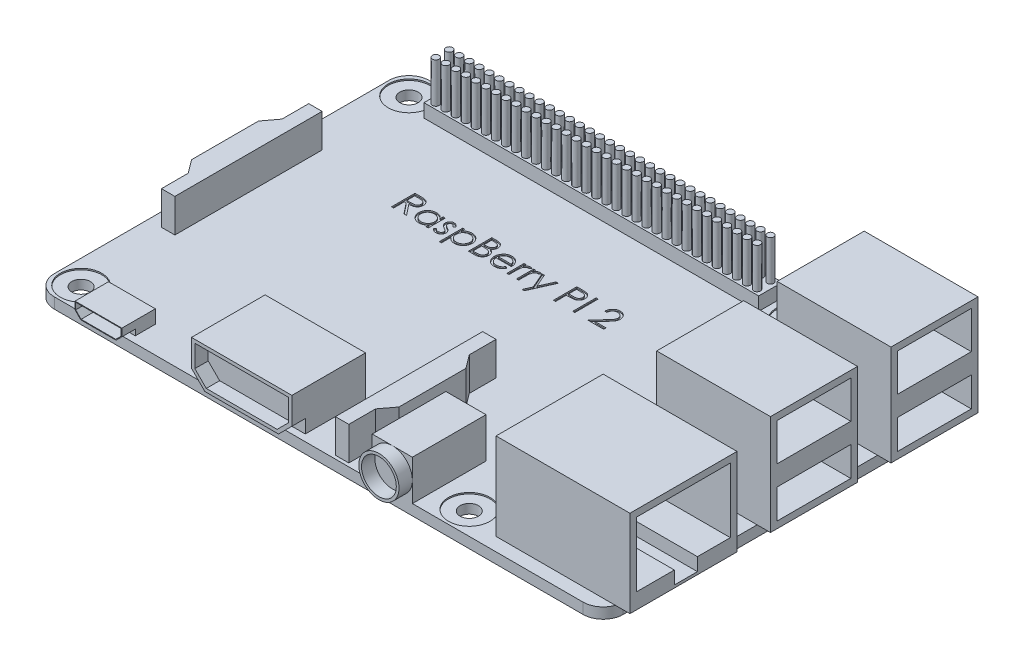
from build123d import *

# Parameters (mm, degrees)
ESQUISSE1_R              = 1.375
PLAQUE_DEPTH             = 1.6
ESQUISSE2_W              = 17
ESQUISSE2_H              = 13
USB_DEPTH                = 15
ESQUISSE3_W              = 20
ESQUISSE3_H              = 16
RJ45_DEPTH               = 13
ESQUISSE4_W              = 50
ESQUISSE4_H              = 3.531908002
GPIO_BASE_DEPTH          = 2
ESQUISSE5_R              = 0.5
GPIO_PINS_DEPTH          = 6
ESQUISSE6_W              = 15
ESQUISSE6_H              = 11
HDMI_DEPTH               = 6
ESQUISSE9_W              = 11
ESQUISSE9_H              = 4.4
ESQUISSE9_H_2            = 5.6
USB_RJ45_VIDE_DEPTH      = 10
HDMI_VIDE_DEPTH          = 2
ESQUISSE11_W             = 0.314102564
ESQUISSE11_H             = 3.5
RASPBERRY_PI_2_DEPTH     = 0.2
CONNECTIQUES_DEPTH       = 5
MICRO_SD_DEPTH           = 1
ESQUISSE14_W             = 6
ESQUISSE14_H             = 11
JACK_BASE_DEPTH          = 6
ESQUISSE15_R             = 3
ESQUISSE15_R_2           = 2.6
JACK_ROND_DEPTH          = 2
ESQUISSE16_R             = 3.1
TROU_FIXATION_VIDE_DEPTH = 0.2
ESQUISSE17_W             = 7
ESQUISSE17_H             = 5
MICRO_USB_BASE_DEPTH     = 2
MICRO_USB_VIDE_DEPTH     = 2


with BuildPart() as part:
    # Esquisse1 → plaque (new body)
    with BuildSketch(Plane(origin=(0, 0, 0), x_dir=(1, 0, 0), z_dir=(0, 1, 0))):
        with BuildLine():
            Line((39.5, 28), (-39.5, 28))
            ThreePointArc((-39.5, 28), (-41.621320344, 27.121320344), (-42.5, 25))
            Line((-42.5, 25), (-42.5, -25))
            ThreePointArc((-42.5, -25), (-41.621320344, -27.121320344), (-39.5, -28))
            Line((-39.5, -28), (39.5, -28))
            ThreePointArc((39.5, -28), (41.621320344, -27.121320344), (42.5, -25))
            Line((42.5, -25), (42.5, 25))
            ThreePointArc((42.5, 25), (41.621320344, 27.121320344), (39.5, 28))
        make_face()
        with Locations((-39, 24.5)):
            Circle(ESQUISSE1_R, mode=Mode.SUBTRACT)
        with Locations((19, 24.5)):
            Circle(ESQUISSE1_R, mode=Mode.SUBTRACT)
        with Locations((19, -24.5)):
            Circle(ESQUISSE1_R, mode=Mode.SUBTRACT)
        with Locations((-39, -24.5)):
            Circle(ESQUISSE1_R, mode=Mode.SUBTRACT)
    extrude(amount=PLAQUE_DEPTH)

    # Esquisse2 → USB (add)
    with BuildSketch(Plane(origin=(0, 1.6, 0), x_dir=(1, 0, 0), z_dir=(0, 1, 0))):
        with Locations((36, 19.5)):
            Rectangle(ESQUISSE2_W, ESQUISSE2_H)
        with Locations((36, 1.5)):
            Rectangle(ESQUISSE2_W, ESQUISSE2_H)
    extrude(amount=USB_DEPTH)

    # Esquisse3 → RJ45 (add)
    with BuildSketch(Plane(origin=(0, 1.6, 0), x_dir=(1, 0, 0), z_dir=(0, 1, 0))):
        with Locations((34.5, -18)):
            Rectangle(ESQUISSE3_W, ESQUISSE3_H)
    extrude(amount=RJ45_DEPTH)

    # Esquisse4 → GPIO_Base (add)
    with BuildSketch(Plane(origin=(0, 1.6, 0), x_dir=(1, 0, 0), z_dir=(0, 1, 0))):
        with Locations((-10, 24.5)):
            Rectangle(ESQUISSE4_W, ESQUISSE4_H)
    extrude(amount=GPIO_BASE_DEPTH)

    # Esquisse5 → GPIO_Pins (add)
    with BuildSketch(Plane(origin=(0, 3.6, 0), x_dir=(1, 0, 0), z_dir=(0, 1, 0))):
        with Locations((-34, 25.5)):
            Circle(ESQUISSE5_R)
        with Locations((-32.5, 25.5)):
            Circle(ESQUISSE5_R)
        with Locations((-31, 25.5)):
            Circle(ESQUISSE5_R)
        with Locations((-29.5, 25.5)):
            Circle(ESQUISSE5_R)
        with Locations((-28, 25.5)):
            Circle(ESQUISSE5_R)
        with Locations((-26.5, 25.5)):
            Circle(ESQUISSE5_R)
        with Locations((-25, 25.5)):
            Circle(ESQUISSE5_R)
        with Locations((-23.5, 25.5)):
            Circle(ESQUISSE5_R)
        with Locations((-22, 25.5)):
            Circle(ESQUISSE5_R)
        with Locations((-20.5, 25.5)):
            Circle(ESQUISSE5_R)
        with Locations((-19, 25.5)):
            Circle(ESQUISSE5_R)
        with Locations((-17.5, 25.5)):
            Circle(ESQUISSE5_R)
        with Locations((-16, 25.5)):
            Circle(ESQUISSE5_R)
        with Locations((-14.5, 25.5)):
            Circle(ESQUISSE5_R)
        with Locations((-13, 25.5)):
            Circle(ESQUISSE5_R)
        with Locations((-11.5, 25.5)):
            Circle(ESQUISSE5_R)
        with Locations((-10, 25.5)):
            Circle(ESQUISSE5_R)
        with Locations((-8.5, 25.5)):
            Circle(ESQUISSE5_R)
        with Locations((-7, 25.5)):
            Circle(ESQUISSE5_R)
        with Locations((-5.5, 25.5)):
            Circle(ESQUISSE5_R)
        with Locations((-4, 25.5)):
            Circle(ESQUISSE5_R)
        with Locations((-2.5, 25.5)):
            Circle(ESQUISSE5_R)
        with Locations((-1, 25.5)):
            Circle(ESQUISSE5_R)
        with Locations((0.5, 25.5)):
            Circle(ESQUISSE5_R)
        with Locations((2, 25.5)):
            Circle(ESQUISSE5_R)
        with Locations((3.5, 25.5)):
            Circle(ESQUISSE5_R)
        with Locations((5, 25.5)):
            Circle(ESQUISSE5_R)
        with Locations((6.5, 25.5)):
            Circle(ESQUISSE5_R)
        with Locations((8, 25.5)):
            Circle(ESQUISSE5_R)
        with Locations((9.5, 25.5)):
            Circle(ESQUISSE5_R)
        with Locations((11, 25.5)):
            Circle(ESQUISSE5_R)
        with Locations((12.5, 25.5)):
            Circle(ESQUISSE5_R)
        with Locations((14, 25.5)):
            Circle(ESQUISSE5_R)
        with Locations((-32.5, 23.5)):
            Circle(ESQUISSE5_R)
        with Locations((-31, 23.5)):
            Circle(ESQUISSE5_R)
        with Locations((-29.5, 23.5)):
            Circle(ESQUISSE5_R)
        with Locations((-28, 23.5)):
            Circle(ESQUISSE5_R)
        with Locations((-26.5, 23.5)):
            Circle(ESQUISSE5_R)
        with Locations((-25, 23.5)):
            Circle(ESQUISSE5_R)
        with Locations((-23.5, 23.5)):
            Circle(ESQUISSE5_R)
        with Locations((-22, 23.5)):
            Circle(ESQUISSE5_R)
        with Locations((-20.5, 23.5)):
            Circle(ESQUISSE5_R)
        with Locations((-19, 23.5)):
            Circle(ESQUISSE5_R)
        with Locations((-17.5, 23.5)):
            Circle(ESQUISSE5_R)
        with Locations((-16, 23.5)):
            Circle(ESQUISSE5_R)
        with Locations((-14.5, 23.5)):
            Circle(ESQUISSE5_R)
        with Locations((-13, 23.5)):
            Circle(ESQUISSE5_R)
        with Locations((-11.5, 23.5)):
            Circle(ESQUISSE5_R)
        with Locations((-10, 23.5)):
            Circle(ESQUISSE5_R)
        with Locations((-8.5, 23.5)):
            Circle(ESQUISSE5_R)
        with Locations((-7, 23.5)):
            Circle(ESQUISSE5_R)
        with Locations((-5.5, 23.5)):
            Circle(ESQUISSE5_R)
        with Locations((-4, 23.5)):
            Circle(ESQUISSE5_R)
        with Locations((-2.5, 23.5)):
            Circle(ESQUISSE5_R)
        with Locations((-1, 23.5)):
            Circle(ESQUISSE5_R)
        with Locations((0.5, 23.5)):
            Circle(ESQUISSE5_R)
        with Locations((2, 23.5)):
            Circle(ESQUISSE5_R)
        with Locations((3.5, 23.5)):
            Circle(ESQUISSE5_R)
        with Locations((5, 23.5)):
            Circle(ESQUISSE5_R)
        with Locations((6.5, 23.5)):
            Circle(ESQUISSE5_R)
        with Locations((8, 23.5)):
            Circle(ESQUISSE5_R)
        with Locations((9.5, 23.5)):
            Circle(ESQUISSE5_R)
        with Locations((11, 23.5)):
            Circle(ESQUISSE5_R)
        with Locations((12.5, 23.5)):
            Circle(ESQUISSE5_R)
        with Locations((14, 23.5)):
            Circle(ESQUISSE5_R)
        with Locations((-34, 23.5)):
            Circle(ESQUISSE5_R)
    extrude(amount=GPIO_PINS_DEPTH)

    # Esquisse6 → HDMI (add)
    with BuildSketch(Plane(origin=(0, 1.6, 0), x_dir=(1, 0, 0), z_dir=(0, 1, 0))):
        with Locations((-10.5, -23.5)):
            Rectangle(ESQUISSE6_W, ESQUISSE6_H)
    extrude(amount=HDMI_DEPTH)

    # Esquisse9 → USB - RJ45 - VIDE (cut)
    with BuildSketch(Plane(origin=(44.5, 0, 0), x_dir=(0, 0, -1), z_dir=(1, 0, 0))):
        with Locations((1.5, 4.8)):
            Rectangle(ESQUISSE9_W, ESQUISSE9_H)
        with Locations((1.5, 12.8)):
            Rectangle(ESQUISSE9_W, ESQUISSE9_H_2)
        with Locations((19.5, 4.8)):
            Rectangle(ESQUISSE9_W, ESQUISSE9_H)
        with Locations((19.5, 12.8)):
            Rectangle(ESQUISSE9_W, ESQUISSE9_H_2)
        Polygon((-25, 13.6), (-11, 13.6), (-11, 3.939955321), (-15.916596502, 3.939955321), (-15.916596502, 2), (-19.365847703, 2), (-19.365847703, 3.939955321), (-25, 3.939955321), align=None)
    extrude(amount=-USB_RJ45_VIDE_DEPTH, mode=Mode.SUBTRACT)

    # Esquisse10 → HDMI - VIDE (cut)
    with BuildSketch(Plane.XY.offset(29)):
        Polygon((-15.792893219, 2.1), (-5.207106781, 2.1), (-3.5, 3.807106781), (-3.5, 7.1), (-17.5, 7.1), (-17.5, 3.807106781), align=None)
        Polygon((-3, 3.6), (-5, 1.6), (-3, 1.6), align=None)
        Polygon((-16, 1.6), (-18, 3.6), (-18, 1.6), align=None)
    extrude(amount=-HDMI_VIDE_DEPTH, mode=Mode.SUBTRACT)

    # Esquisse11 → RaspBerry Pi 2 (cut)
    # profile 1 of 12: a face of its own
    with BuildSketch(Plane(origin=(0, 1.6, 0), x_dir=(1, 0, 0), z_dir=(0, 1, 0))):
        with BuildLine():
            Line((-25.952838551, 12.338157917), (-25.252417878, 12.338157917))
            add(Edge.make_bspline(
                [(-25.252417878, 12.338157917), (-25.205676749, 12.338002331), (-25.115928605, 12.337703588), (-24.987355334, 12.336037825), (-24.870528237, 12.33126347), (-24.765508398, 12.327154886), (-24.672297743, 12.319662945), (-24.590610452, 12.312502298), (-24.520822755, 12.303128637), (-24.478576903, 12.294423214), (-24.459449128, 12.290481635)],
                knots=[0, 0, 0, 0, 1.410062039, 2.707475311, 3.878576406, 4.937260626, 5.877586885, 6.699081471, 7.410979367, 8, 8, 8, 8], degree=3))
            add(Edge.make_bspline(
                [(-24.459449128, 12.290481635), (-24.433842503, 12.284154869), (-24.383175514, 12.271636306), (-24.310225448, 12.245176705), (-24.240711124, 12.21455708), (-24.1749213, 12.17859336), (-24.113185508, 12.13701858), (-24.054867198, 12.090550458), (-23.999701734, 12.039443252), (-23.949920104, 11.98240841), (-23.902981052, 11.922571901), (-23.863392426, 11.857868144), (-23.829265946, 11.790206616), (-23.802095429, 11.718899199), (-23.780217456, 11.644637427), (-23.764791216, 11.56674863), (-23.755540029, 11.485587655), (-23.754598173, 11.430229746), (-23.754120602, 11.40216032)],
                knots=[0, 0, 0, 0, 1.027469482, 2.033020251, 3.019912614, 3.986113645, 4.951240523, 5.91722682, 6.890402269, 7.87763091, 8.8651537, 9.85103654, 10.82876324, 11.815024772, 12.821070561, 13.842952187, 14.906261191, 16, 16, 16, 16], degree=3))
            add(Edge.make_bspline(
                [(-23.754120602, 11.40216032), (-23.7555896, 11.355525216), (-23.758455996, 11.264528048), (-23.785181099, 11.132467167), (-23.828957619, 11.009277852), (-23.889280908, 10.895115214), (-23.966100384, 10.792204569), (-24.058425175, 10.701814113), (-24.166306787, 10.626174201), (-24.266736102, 10.573721396), (-24.355450302, 10.540128487), (-24.428483615, 10.516492129), (-24.508150592, 10.498230163), (-24.593687927, 10.481870032), (-24.685451583, 10.469518337), (-24.783221622, 10.460471743), (-24.887067774, 10.454817694), (-24.958406843, 10.453975689), (-24.995106179, 10.453542532)],
                knots=[0, 0, 0, 0, 1.260483769, 2.459530307, 3.627416485, 4.787058657, 5.939039949, 7.08810263, 8.267026773, 9.491475466, 10.141966685, 10.831826277, 11.566392101, 12.351337768, 13.187381173, 14.07005841, 15.007169909, 16, 16, 16, 16], degree=3))
            Line((-24.995106179, 10.453542532), (-23.709248807, 8.838157917))
            Line((-23.709248807, 8.838157917), (-24.097670281, 8.838157917))
            Line((-24.097670281, 8.838157917), (-25.383527653, 10.453542532))
            Line((-25.383527653, 10.453542532), (-25.638735987, 10.453542532))
            Line((-25.638735987, 10.453542532), (-25.638735987, 8.838157917))
            Line((-25.638735987, 8.838157917), (-25.952838551, 8.838157917))
            Line((-25.952838551, 8.838157917), (-25.952838551, 12.338157917))
        make_face()
        with BuildLine():
            Line((-25.638735987, 11.979183558), (-25.638735987, 10.812516891))
            Line((-25.638735987, 10.812516891), (-24.997910666, 10.807609038))
            add(Edge.make_bspline(
                [(-24.997910666, 10.807609038), (-24.967990627, 10.807595802), (-24.90999707, 10.807570145), (-24.826096405, 10.811563922), (-24.747976293, 10.81610724), (-24.675935541, 10.823056585), (-24.609941966, 10.832012657), (-24.550028553, 10.843215641), (-24.496097501, 10.856267704), (-24.433198962, 10.87646933), (-24.362962431, 10.908475348), (-24.286630971, 10.955040847), (-24.221628633, 11.013609966), (-24.166710771, 11.080583422), (-24.12258134, 11.154219671), (-24.091469285, 11.23363604), (-24.071726843, 11.316827638), (-24.069398298, 11.374005746), (-24.068223166, 11.402861442)],
                knots=[0, 0, 0, 0, 1.146690395, 2.22261258, 3.21895312, 4.145990853, 4.996080663, 5.770904154, 6.481378293, 7.121626537, 8.300444488, 9.431385265, 10.535395872, 11.636531494, 12.74115979, 13.810798291, 14.895190096, 16, 16, 16, 16], degree=3))
            add(Edge.make_bspline(
                [(-24.068223166, 11.402861442), (-24.069425287, 11.431008016), (-24.071807452, 11.486784255), (-24.091256221, 11.568440165), (-24.124145602, 11.645507115), (-24.16846784, 11.7176716), (-24.222466995, 11.783177336), (-24.285784808, 11.839224489), (-24.356690003, 11.885473954), (-24.422961201, 11.915028334), (-24.482195414, 11.933148187), (-24.533625074, 11.945899351), (-24.591736552, 11.95614382), (-24.65681201, 11.964351881), (-24.728573641, 11.971406825), (-24.807384292, 11.976158604), (-24.892721072, 11.978972468), (-24.951868004, 11.979111557), (-24.982485987, 11.979183558)],
                knots=[0, 0, 0, 0, 1.101028733, 2.181837193, 3.264309656, 4.369019818, 5.486613113, 6.575447106, 7.666700264, 8.788928104, 9.402425223, 10.0903467, 10.862060571, 11.710948788, 12.657782767, 13.684531032, 14.801375019, 16, 16, 16, 16], degree=3))
            Line((-24.982485987, 11.979183558), (-25.638735987, 11.979183558))
        make_face(mode=Mode.SUBTRACT)
    # profile 2 of 12: a face of its own
    with BuildSketch(Plane(origin=(0, 1.6, 0), x_dir=(1, 0, 0), z_dir=(0, 1, 0))):
        with BuildLine():
            Line((-20.478479576, 11.395850224), (-20.478479576, 8.838157917))
            Line((-20.478479576, 8.838157917), (-20.79258214, 8.838157917))
            Line((-20.79258214, 8.838157917), (-20.79258214, 9.280565769))
            add(Edge.make_bspline(
                [(-20.79258214, 9.280565769), (-20.828000931, 9.240526175), (-20.897121146, 9.162388404), (-21.012562264, 9.060306232), (-21.134930442, 8.97592791), (-21.263631763, 8.907777994), (-21.398550007, 8.856585938), (-21.539386094, 8.820199779), (-21.686197475, 8.796805944), (-21.78644983, 8.794469922), (-21.837253615, 8.793286122)],
                knots=[0, 0, 0, 0, 1.074387032, 2.096679803, 3.090159297, 4.057316773, 5.018401886, 5.985159533, 6.978961417, 8, 8, 8, 8], degree=3))
            add(Edge.make_bspline(
                [(-21.837253615, 8.793286122), (-21.882421569, 8.794512494), (-21.971494773, 8.796930954), (-22.102523851, 8.815693258), (-22.2286161, 8.84582388), (-22.349890673, 8.887724769), (-22.465562818, 8.943305591), (-22.576622915, 9.009846839), (-22.682495607, 9.089087669), (-22.781567146, 9.179675697), (-22.872799146, 9.278070684), (-22.952860419, 9.383016231), (-23.019613499, 9.494058535), (-23.075433579, 9.609791689), (-23.118429924, 9.731106609), (-23.148403558, 9.857583777), (-23.167144005, 9.98907365), (-23.169561465, 10.078613173), (-23.170787269, 10.124015288)],
                knots=[0, 0, 0, 0, 1.033919861, 2.038935746, 3.024066025, 3.998881131, 4.97069526, 5.957263378, 6.95902576, 7.993208707, 9.027059324, 10.027763471, 11.009749337, 11.988697705, 12.965288445, 13.950418724, 14.960734635, 16, 16, 16, 16], degree=3))
            add(Edge.make_bspline(
                [(-23.170787269, 10.124015288), (-23.169534297, 10.168478992), (-23.16705724, 10.256381335), (-23.148604021, 10.385660033), (-23.117573012, 10.510178294), (-23.074025164, 10.629535237), (-23.018183209, 10.743875287), (-22.950255122, 10.853279312), (-22.870235997, 10.95804871), (-22.77798359, 11.055719937), (-22.67804882, 11.145940551), (-22.571140089, 11.224349596), (-22.459916808, 11.292066445), (-22.342653798, 11.345719922), (-22.221086693, 11.389129026), (-22.094133247, 11.419161994), (-21.962321668, 11.436859315), (-21.872831176, 11.43942208), (-21.82743791, 11.440722019)],
                knots=[0, 0, 0, 0, 1.020392517, 2.01726096, 2.990465484, 3.961182959, 4.928053699, 5.906110375, 6.912531644, 7.948652711, 8.985773172, 9.998621852, 10.987621588, 11.969261332, 12.953316658, 13.946091881, 14.958173133, 16, 16, 16, 16], degree=3))
            add(Edge.make_bspline(
                [(-21.82743791, 11.440722019), (-21.775238051, 11.439284268), (-21.672876591, 11.436464905), (-21.523148581, 11.413002177), (-21.381504103, 11.37336371), (-21.246849751, 11.319446212), (-21.119669065, 11.247797483), (-21.001166081, 11.157417522), (-20.890100598, 11.048876335), (-20.825720306, 10.965505891), (-20.79258214, 10.922593013)],
                knots=[0, 0, 0, 0, 1.038897134, 2.037228247, 3.008116434, 3.962042015, 4.918381754, 5.904844433, 6.921570401, 8, 8, 8, 8], degree=3))
            Line((-20.79258214, 10.922593013), (-20.79258214, 11.395850224))
            Line((-20.79258214, 11.395850224), (-20.478479576, 11.395850224))
        make_face()
        with BuildLine():
            add(Edge.make_bspline(
                [(-21.823231179, 11.126619455), (-21.869145517, 11.124985817), (-21.959773117, 11.121761276), (-22.092817119, 11.096587781), (-22.220130533, 11.054703187), (-22.341076607, 10.997421286), (-22.453744824, 10.925392549), (-22.554438495, 10.838271166), (-22.643981196, 10.738434152), (-22.71928946, 10.626332041), (-22.780679957, 10.50615395), (-22.823846989, 10.380529512), (-22.852316236, 10.251724534), (-22.855224757, 10.164361849), (-22.856684704, 10.120509679)],
                knots=[0, 0, 0, 0, 1.031046209, 2.035121221, 3.029706178, 4.034933723, 5.034054252, 6.02443088, 7.017295772, 8.038157696, 9.050218397, 10.03989886, 11.016116709, 12, 12, 12, 12], degree=3))
            add(Edge.make_bspline(
                [(-22.856684704, 10.120509679), (-22.854819811, 10.076919572), (-22.851097334, 9.989910216), (-22.82434664, 9.86092964), (-22.779466766, 9.735275598), (-22.718224704, 9.614014604), (-22.641538079, 9.501430504), (-22.552649426, 9.399690381), (-22.450699145, 9.312200793), (-22.337771638, 9.238963219), (-22.217163668, 9.179800698), (-22.090329736, 9.138635059), (-21.959654098, 9.112057278), (-21.870801764, 9.108952801), (-21.826035666, 9.107388686)],
                knots=[0, 0, 0, 0, 0.979072187, 1.954306742, 2.945804271, 3.96968567, 4.997920485, 5.998718438, 6.996577872, 8.005894225, 9.015743152, 10.005417472, 10.995077863, 12, 12, 12, 12], degree=3))
            add(Edge.make_bspline(
                [(-21.826035666, 9.107388686), (-21.780589163, 9.10904865), (-21.690200577, 9.112350153), (-21.556761869, 9.137631419), (-21.427266906, 9.179400217), (-21.303479678, 9.237299344), (-21.188163547, 9.3090567), (-21.084665669, 9.393063791), (-20.997149701, 9.490766975), (-20.922957091, 9.598143428), (-20.864781674, 9.715855424), (-20.822405615, 9.841189615), (-20.797351709, 9.974150363), (-20.79419398, 10.06501429), (-20.79258214, 10.111395096)],
                knots=[0, 0, 0, 0, 1.01762866, 2.023962475, 3.030623092, 4.058876274, 5.077231937, 6.066672613, 7.034107872, 8.005628644, 8.981990164, 9.965428785, 10.961468474, 12, 12, 12, 12], degree=3))
            add(Edge.make_bspline(
                [(-20.79258214, 10.111395096), (-20.793541797, 10.146732927), (-20.795430704, 10.21628896), (-20.809861274, 10.318416478), (-20.8328162, 10.416150204), (-20.86516237, 10.509592893), (-20.907653655, 10.598227908), (-20.95890142, 10.682691668), (-21.01980687, 10.76254488), (-21.089389566, 10.836687951), (-21.165554769, 10.904314413), (-21.246149309, 10.964678654), (-21.332128056, 11.014267426), (-21.422045093, 11.055308698), (-21.516056428, 11.087967848), (-21.614927048, 11.109755541), (-21.717606035, 11.124715863), (-21.78765209, 11.125978243), (-21.823231179, 11.126619455)],
                knots=[0, 0, 0, 0, 1.050140795, 2.067009409, 3.05949893, 4.030605086, 5.00011959, 5.97591094, 6.962425594, 7.979863591, 8.993523472, 9.986985069, 10.967611495, 11.937549037, 12.921786183, 13.919465291, 14.943216303, 16, 16, 16, 16], degree=3))
        make_face(mode=Mode.SUBTRACT)
    # profile 3 of 12: a face of its own
    with BuildSketch(Plane(origin=(0, 1.6, 0), x_dir=(1, 0, 0), z_dir=(0, 1, 0))):
        with BuildLine():
            Line((-18.548992397, 11.076839808), (-18.762133422, 10.857388686))
            add(Edge.make_bspline(
                [(-18.762133422, 10.857388686), (-18.780523926, 10.878701832), (-18.815978652, 10.919791069), (-18.872210133, 10.974728136), (-18.928233736, 11.020865075), (-18.98328255, 11.059817334), (-19.038740819, 11.08926648), (-19.093957737, 11.110761342), (-19.148990476, 11.124063148), (-19.185776511, 11.125777586), (-19.203840153, 11.126619455)],
                knots=[0, 0, 0, 0, 1.26578478, 2.440284043, 3.530471711, 4.527705817, 5.468200915, 6.346673037, 7.188140097, 8, 8, 8, 8], degree=3))
            add(Edge.make_bspline(
                [(-19.203840153, 11.126619455), (-19.225979543, 11.125544582), (-19.269546729, 11.123429384), (-19.331972547, 11.102315954), (-19.389923172, 11.069907215), (-19.440080152, 11.023938632), (-19.482567832, 10.971174363), (-19.513581513, 10.912178038), (-19.532547497, 10.848729994), (-19.534952229, 10.804700137), (-19.536171884, 10.782368654)],
                knots=[0, 0, 0, 0, 0.99966794, 1.967205029, 2.953328237, 3.988086729, 5.028030931, 6.008226631, 6.989793394, 8, 8, 8, 8], degree=3))
            add(Edge.make_bspline(
                [(-19.536171884, 10.782368654), (-19.535061072, 10.76215661), (-19.532842579, 10.721789499), (-19.515595899, 10.662241465), (-19.488129827, 10.604184427), (-19.462459633, 10.56862152), (-19.449232781, 10.55029734)],
                knots=[0, 0, 0, 0, 0.960159726, 1.917612774, 2.927026955, 4, 4, 4, 4], degree=3))
            add(Edge.make_bspline(
                [(-19.449232781, 10.55029734), (-19.441269288, 10.540512755), (-19.424319995, 10.519687501), (-19.39251148, 10.490783647), (-19.356488977, 10.458841396), (-19.313169039, 10.426904559), (-19.264418011, 10.393272834), (-19.209178727, 10.359270701), (-19.149204222, 10.322306276), (-19.106266916, 10.298861841), (-19.083948326, 10.286675545)],
                knots=[0, 0, 0, 0, 0.66740084, 1.420478572, 2.27185888, 3.217733974, 4.268547843, 5.408967954, 6.65319498, 8, 8, 8, 8], degree=3))
            add(Edge.make_bspline(
                [(-19.083948326, 10.286675545), (-19.056734749, 10.271430642), (-19.004167079, 10.24198251), (-18.929474312, 10.196272806), (-18.861687271, 10.150841382), (-18.800231603, 10.106174108), (-18.746289794, 10.06102124), (-18.698225242, 10.017113483), (-18.657236798, 9.973124175), (-18.634282871, 9.942391061), (-18.623311307, 9.927701186)],
                knots=[0, 0, 0, 0, 1.27191281, 2.456916733, 3.569705269, 4.599008579, 5.553216877, 6.436649441, 7.252746552, 8, 8, 8, 8], degree=3))
            add(Edge.make_bspline(
                [(-18.623311307, 9.927701186), (-18.60510078, 9.898035098), (-18.56885845, 9.838994077), (-18.530800184, 9.741775649), (-18.508739909, 9.638665147), (-18.505677689, 9.568132927), (-18.504120602, 9.532268494)],
                knots=[0, 0, 0, 0, 0.995354457, 1.980940102, 2.973342416, 4, 4, 4, 4], degree=3))
            add(Edge.make_bspline(
                [(-18.504120602, 9.532268494), (-18.504840136, 9.506999347), (-18.506258056, 9.457203734), (-18.516116123, 9.383868904), (-18.533071099, 9.313734347), (-18.556164853, 9.246039062), (-18.587349226, 9.182080123), (-18.623897023, 9.120243874), (-18.667771935, 9.061867943), (-18.71786331, 9.007028983), (-18.772708804, 8.956943235), (-18.831214943, 8.912919281), (-18.893453773, 8.876344944), (-18.958980575, 8.846079599), (-19.027944229, 8.822011341), (-19.100355518, 8.80534881), (-19.175984273, 8.795376049), (-19.227414081, 8.793991572), (-19.253619801, 8.793286122)],
                knots=[0, 0, 0, 0, 1.032770009, 2.035186124, 3.017557409, 3.978232242, 4.952395191, 5.920591857, 6.910227898, 7.931268572, 8.952309245, 9.941945286, 10.918353717, 11.897095711, 12.887975737, 13.898235213, 14.929059601, 16, 16, 16, 16], degree=3))
            add(Edge.make_bspline(
                [(-19.253619801, 8.793286122), (-19.288986976, 8.794278822), (-19.359229903, 8.796250429), (-19.463119622, 8.81475649), (-19.564640381, 8.843551884), (-19.663023921, 8.883267819), (-19.756070035, 8.933418531), (-19.84120096, 8.993480925), (-19.918712422, 9.061470922), (-19.962830696, 9.113583833), (-19.984889833, 9.139640288)],
                knots=[0, 0, 0, 0, 1.013940152, 2.01379169, 3.017749504, 4.037548394, 5.051665909, 6.043208538, 7.021604269, 8, 8, 8, 8], degree=3))
            Line((-19.984889833, 9.139640288), (-19.77665666, 9.376619455))
            add(Edge.make_bspline(
                [(-19.77665666, 9.376619455), (-19.756884247, 9.355264691), (-19.718552434, 9.313865251), (-19.657251218, 9.25874091), (-19.594871817, 9.212539639), (-19.53203713, 9.173896224), (-19.467817036, 9.144120821), (-19.402571421, 9.123202227), (-19.336432997, 9.109758035), (-19.292010861, 9.108179752), (-19.269745602, 9.107388686)],
                knots=[0, 0, 0, 0, 1.179806542, 2.287233372, 3.337373186, 4.324005949, 5.273901747, 6.200048787, 7.097828587, 8, 8, 8, 8], degree=3))
            add(Edge.make_bspline(
                [(-19.269745602, 9.107388686), (-19.239427676, 9.108759511), (-19.180191534, 9.111437873), (-19.095347776, 9.135754965), (-19.017009149, 9.173884916), (-18.948985804, 9.227969615), (-18.891083643, 9.290925187), (-18.849155468, 9.361839306), (-18.822879293, 9.438630763), (-18.819793294, 9.491863066), (-18.818223166, 9.518947179)],
                knots=[0, 0, 0, 0, 1.072336372, 2.095165389, 3.102688358, 4.141489647, 5.156069229, 6.117746104, 7.042326257, 8, 8, 8, 8], degree=3))
            add(Edge.make_bspline(
                [(-18.818223166, 9.518947179), (-18.81930946, 9.541256798), (-18.821454203, 9.585304154), (-18.838297475, 9.649054495), (-18.864910327, 9.709523775), (-18.891114976, 9.744913423), (-18.904461147, 9.762937564)],
                knots=[0, 0, 0, 0, 1.013901739, 2.00181326, 2.98231254, 4, 4, 4, 4], degree=3))
            add(Edge.make_bspline(
                [(-18.904461147, 9.762937564), (-18.912483541, 9.771972926), (-18.929959214, 9.791655208), (-18.962014455, 9.820080287), (-19.000396317, 9.850718386), (-19.04553648, 9.883049975), (-19.097525942, 9.91664858), (-19.156575417, 9.951337933), (-19.22187597, 9.988765658), (-19.268046601, 10.013585314), (-19.292181499, 10.026559359)],
                knots=[0, 0, 0, 0, 0.615000592, 1.339693406, 2.178160186, 3.116406724, 4.166410947, 5.330106347, 6.604359322, 8, 8, 8, 8], degree=3))
            add(Edge.make_bspline(
                [(-19.292181499, 10.026559359), (-19.318228139, 10.041098491), (-19.368740887, 10.069294507), (-19.440288178, 10.113210587), (-19.504835532, 10.157877862), (-19.563936107, 10.200790701), (-19.616097112, 10.244211645), (-19.661113061, 10.288188896), (-19.700756276, 10.330948883), (-19.722703688, 10.361246179), (-19.733187108, 10.375718013)],
                knots=[0, 0, 0, 0, 1.262093308, 2.447601706, 3.550203992, 4.582594899, 5.537233252, 6.418365656, 7.244515135, 8, 8, 8, 8], degree=3))
            add(Edge.make_bspline(
                [(-19.733187108, 10.375718013), (-19.751317708, 10.404863628), (-19.787585243, 10.463165043), (-19.822800434, 10.56047552), (-19.847006463, 10.662920577), (-19.849168853, 10.733607431), (-19.850274448, 10.769748461)],
                knots=[0, 0, 0, 0, 0.985009483, 1.970363186, 2.962279964, 4, 4, 4, 4], degree=3))
            add(Edge.make_bspline(
                [(-19.850274448, 10.769748461), (-19.849740253, 10.793373859), (-19.848694757, 10.83961211), (-19.840350705, 10.907550931), (-19.825158994, 10.972099085), (-19.806104071, 11.034225948), (-19.779621067, 11.092728042), (-19.747975162, 11.148385513), (-19.710787737, 11.201121431), (-19.667944446, 11.250124563), (-19.620837801, 11.294633889), (-19.569943031, 11.333432517), (-19.516404775, 11.366538872), (-19.459996355, 11.394304032), (-19.400175882, 11.415305415), (-19.337361496, 11.4297628), (-19.271680341, 11.439418003), (-19.226779215, 11.440281087), (-19.203840153, 11.440722019)],
                knots=[0, 0, 0, 0, 1.087655834, 2.128696564, 3.144119009, 4.137814668, 5.115653402, 6.093965665, 7.082169637, 8.081268856, 9.086088321, 10.061021666, 11.022561449, 11.980240094, 12.950172527, 13.934149372, 14.944599409, 16, 16, 16, 16], degree=3))
            add(Edge.make_bspline(
                [(-19.203840153, 11.440722019), (-19.17664809, 11.439617678), (-19.121753868, 11.437388281), (-19.039399242, 11.41968259), (-18.9571659, 11.390549486), (-18.87484255, 11.350313253), (-18.79303226, 11.298246377), (-18.711015404, 11.235317078), (-18.627807373, 11.161939363), (-18.57585106, 11.105840138), (-18.548992397, 11.076839808)],
                knots=[0, 0, 0, 0, 0.845714091, 1.707292901, 2.609013841, 3.555613372, 4.552488639, 5.621697636, 6.770543573, 8, 8, 8, 8], degree=3))
        make_face()
    # profile 4 of 12: a face of its own
    with BuildSketch(Plane(origin=(0, 1.6, 0), x_dir=(1, 0, 0), z_dir=(0, 1, 0))):
        with BuildLine():
            Line((-17.875915474, 11.395850224), (-17.56181291, 11.395850224))
            Line((-17.56181291, 11.395850224), (-17.56181291, 10.922593013))
            add(Edge.make_bspline(
                [(-17.56181291, 10.922593013), (-17.528455426, 10.965530747), (-17.463631831, 11.048971639), (-17.351906926, 11.156961768), (-17.233980117, 11.248037072), (-17.106816705, 11.319419605), (-16.972393015, 11.373240417), (-16.831260697, 11.413019867), (-16.682221932, 11.436461341), (-16.58032548, 11.439283002), (-16.528359384, 11.440722019)],
                knots=[0, 0, 0, 0, 1.0828784, 2.104357462, 3.088488658, 4.04616522, 5.001424249, 5.969181776, 6.964304535, 8, 8, 8, 8], degree=3))
            add(Edge.make_bspline(
                [(-16.528359384, 11.440722019), (-16.482967781, 11.43940884), (-16.393248892, 11.436813273), (-16.261185664, 11.419240219), (-16.13401028, 11.389122526), (-16.012442226, 11.345721611), (-15.895179161, 11.292066141), (-15.783957061, 11.224349105), (-15.677043505, 11.145942915), (-15.577127316, 11.055710764), (-15.484805949, 10.958082497), (-15.404959768, 10.853060193), (-15.336087863, 10.744097607), (-15.280417567, 10.629505515), (-15.236809219, 10.510186285), (-15.205794542, 10.385657844), (-15.187336898, 10.256381903), (-15.184860447, 10.168479183), (-15.183607781, 10.124015288)],
                knots=[0, 0, 0, 0, 1.041296284, 2.058176809, 3.050446431, 4.034000596, 5.01514041, 6.003636468, 7.015969324, 8.052561599, 9.08815499, 10.094063707, 11.074456064, 12.040834395, 13.011057502, 13.983766392, 14.980127149, 16, 16, 16, 16], degree=3))
            add(Edge.make_bspline(
                [(-15.183607781, 10.124015288), (-15.184833267, 10.07861298), (-15.187250101, 9.989073075), (-15.205995107, 9.857585978), (-15.235951981, 9.731098604), (-15.279010165, 9.609821341), (-15.334651653, 9.493837689), (-15.402356213, 9.383231293), (-15.48224268, 9.27803759), (-15.573543808, 9.17968469), (-15.672596744, 9.089085377), (-15.778474234, 9.009847308), (-15.889533159, 8.943305932), (-16.005205326, 8.887722973), (-16.126480965, 8.845830789), (-16.252794242, 8.815612988), (-16.384076389, 8.796978492), (-16.473377541, 8.79452635), (-16.518543679, 8.793286122)],
                knots=[0, 0, 0, 0, 1.038740735, 2.04854663, 3.033179607, 4.009277356, 4.987731542, 5.972001279, 6.972200261, 8.005528982, 9.039189865, 10.040446548, 11.026516639, 11.997840187, 12.972163198, 13.956796175, 14.96660207, 16, 16, 16, 16], degree=3))
            add(Edge.make_bspline(
                [(-16.518543679, 8.793286122), (-16.569371251, 8.794580929), (-16.669770607, 8.797138554), (-16.816568277, 8.823057964), (-16.957845129, 8.8617949), (-17.092035954, 8.918493894), (-17.220203766, 8.99074941), (-17.341623572, 9.078859615), (-17.456940325, 9.18264024), (-17.526349082, 9.261372056), (-17.56181291, 9.301599423)],
                knots=[0, 0, 0, 0, 1.014726462, 2.004382257, 2.969841629, 3.936926163, 4.907207904, 5.903978561, 6.929055279, 8, 8, 8, 8], degree=3))
            Line((-17.56181291, 9.301599423), (-17.56181291, 7.895850224))
            Line((-17.56181291, 7.895850224), (-17.875915474, 7.895850224))
            Line((-17.875915474, 7.895850224), (-17.875915474, 11.395850224))
        make_face()
        with BuildLine():
            add(Edge.make_bspline(
                [(-16.531163871, 11.126619455), (-16.566743434, 11.125979197), (-16.636790421, 11.124718693), (-16.73946264, 11.109744745), (-16.838358068, 11.088007003), (-16.93248002, 11.055095103), (-17.022730636, 11.01469629), (-17.108414801, 10.964214279), (-17.189472368, 10.904562273), (-17.265699399, 10.836882929), (-17.334562692, 10.762308241), (-17.39552562, 10.682720432), (-17.446732925, 10.598220292), (-17.489234946, 10.50959493), (-17.521578228, 10.416149645), (-17.544533948, 10.318416632), (-17.558964301, 10.216288919), (-17.560853238, 10.146732913), (-17.56181291, 10.111395096)],
                knots=[0, 0, 0, 0, 1.05670511, 2.080379991, 3.077984906, 4.06214886, 5.038337365, 6.01289324, 7.01187578, 8.025460281, 9.038092164, 10.024533457, 11.000252242, 11.969694649, 12.940728589, 13.933144304, 14.949937299, 16, 16, 16, 16], degree=3))
            add(Edge.make_bspline(
                [(-17.56181291, 10.111395096), (-17.560222053, 10.065006984), (-17.557105432, 9.974128742), (-17.531768064, 9.84134462), (-17.4905328, 9.715692965), (-17.432004086, 9.598231928), (-17.358056512, 9.490249093), (-17.268958355, 9.393558486), (-17.165515804, 9.308767895), (-17.049448613, 9.237346642), (-16.925026482, 9.179358575), (-16.79524057, 9.137844365), (-16.661875689, 9.112272136), (-16.571707369, 9.109025317), (-16.526256019, 9.107388686)],
                knots=[0, 0, 0, 0, 1.03728447, 2.032128127, 3.01272805, 3.987917167, 4.958271349, 5.931593992, 6.91984656, 7.941419022, 8.973179163, 9.983609215, 10.983593296, 12, 12, 12, 12], degree=3))
            add(Edge.make_bspline(
                [(-16.526256019, 9.107388686), (-16.481720251, 9.108945063), (-16.393324758, 9.112034191), (-16.263166636, 9.138772379), (-16.136675998, 9.179617403), (-16.016495825, 9.23917696), (-15.903672337, 9.312167018), (-15.801790784, 9.399727051), (-15.71278387, 9.501216994), (-15.636919515, 9.614225497), (-15.57578803, 9.735400881), (-15.52985779, 9.860782269), (-15.503349217, 9.989927692), (-15.499592428, 10.076925405), (-15.497710345, 10.120509679)],
                knots=[0, 0, 0, 0, 1.00104056, 1.986885549, 2.97790532, 3.984399681, 4.995088187, 5.994304198, 6.996462723, 8.023150851, 9.048424203, 10.043036403, 11.019596776, 12, 12, 12, 12], degree=3))
            add(Edge.make_bspline(
                [(-15.497710345, 10.120509679), (-15.499165079, 10.164364669), (-15.502063213, 10.251732972), (-15.530610251, 10.380495875), (-15.573510229, 10.506383851), (-15.636069281, 10.625904401), (-15.71027055, 10.738678484), (-15.800017547, 10.838232363), (-15.900633743, 10.925403035), (-16.013322907, 10.997418445), (-16.134263333, 11.05470394), (-16.261578249, 11.096587579), (-16.394621851, 11.121761329), (-16.485249506, 11.124985835), (-16.531163871, 11.126619455)],
                knots=[0, 0, 0, 0, 0.983928682, 1.960191568, 2.949917689, 3.96440592, 4.982380491, 5.975291189, 6.965713506, 7.964880129, 8.970154049, 9.96478489, 10.968906225, 12, 12, 12, 12], degree=3))
        make_face(mode=Mode.SUBTRACT)
    # profile 5 of 12: a face of its own
    with BuildSketch(Plane(origin=(0, 1.6, 0), x_dir=(1, 0, 0), z_dir=(0, 1, 0))):
        with BuildLine():
            Line((-14.465659063, 12.338157917), (-13.782766435, 12.338157917))
            add(Edge.make_bspline(
                [(-13.782766435, 12.338157917), (-13.749337957, 12.337982166), (-13.684545247, 12.337641518), (-13.590325805, 12.332358387), (-13.502076994, 12.325154717), (-13.419773222, 12.313724625), (-13.343452519, 12.299932847), (-13.272884882, 12.283231031), (-13.20829471, 12.263204418), (-13.131181974, 12.231358136), (-13.043261313, 12.184034968), (-12.94806292, 12.114106403), (-12.866658681, 12.02857394), (-12.796472363, 11.932091284), (-12.740671244, 11.825955513), (-12.700301946, 11.712696324), (-12.674744071, 11.593774582), (-12.672115637, 11.512131404), (-12.670787269, 11.470870256)],
                knots=[0, 0, 0, 0, 1.001505555, 1.941167018, 2.826882275, 3.653841531, 4.429895133, 5.150066043, 5.825578002, 6.45369114, 7.647487171, 8.808567382, 9.977351308, 11.170798116, 12.373658725, 13.556498008, 14.765093433, 16, 16, 16, 16], degree=3))
            add(Edge.make_bspline(
                [(-12.670787269, 11.470870256), (-12.671880487, 11.432217701), (-12.674028764, 11.356261784), (-12.694571524, 11.245167674), (-12.726732192, 11.139416456), (-12.771437441, 11.03939407), (-12.829539437, 10.947360457), (-12.898397756, 10.862573191), (-12.981474559, 10.788622134), (-13.043717799, 10.747279231), (-13.075334544, 10.72627891)],
                knots=[0, 0, 0, 0, 1.044552857, 2.05264487, 3.044412934, 4.028983338, 5.005914585, 5.980388656, 6.974128949, 8, 8, 8, 8], degree=3))
            add(Edge.make_bspline(
                [(-13.075334544, 10.72627891), (-13.035574117, 10.711013911), (-12.959502569, 10.681808187), (-12.854816557, 10.630172723), (-12.764621712, 10.574010612), (-12.688224566, 10.512678762), (-12.622886911, 10.446569952), (-12.565833969, 10.374714837), (-12.517152595, 10.296176079), (-12.475439672, 10.211772544), (-12.442890916, 10.122366076), (-12.418515011, 10.0287953), (-12.404547562, 9.931395744), (-12.402559921, 9.865110365), (-12.401556499, 9.8316475)],
                knots=[0, 0, 0, 0, 1.27268992, 2.434971085, 3.483601985, 4.442670788, 5.356604649, 6.2567628, 7.179492994, 8.113709626, 9.066344395, 10.018646069, 10.999752585, 12, 12, 12, 12], degree=3))
            add(Edge.make_bspline(
                [(-12.401556499, 9.8316475), (-12.402533345, 9.797480628), (-12.404455317, 9.73025635), (-12.418635289, 9.631501215), (-12.442644396, 9.537126269), (-12.475715542, 9.446521086), (-12.518877857, 9.359860951), (-12.571405821, 9.277047687), (-12.634037385, 9.198913357), (-12.704100254, 9.124589734), (-12.783362399, 9.057761946), (-12.868878154, 8.99824624), (-12.961724474, 8.949300178), (-13.060376468, 8.908184156), (-13.165940784, 8.876776958), (-13.277943392, 8.854804384), (-13.396287694, 8.839999347), (-13.477497445, 8.838782142), (-13.51914464, 8.838157917)],
                knots=[0, 0, 0, 0, 0.978564426, 1.925352924, 2.850884081, 3.763762016, 4.682927383, 5.618979971, 6.567305752, 7.547517671, 8.540179244, 9.531824382, 10.526200242, 11.540722885, 12.589160233, 13.674978461, 14.80764778, 16, 16, 16, 16], degree=3))
            Line((-13.51914464, 8.838157917), (-14.465659063, 8.838157917))
            Line((-14.465659063, 8.838157917), (-14.465659063, 12.338157917))
        make_face()
        with BuildLine():
            Line((-14.151556499, 11.979183558), (-14.151556499, 10.857388686))
            Line((-14.151556499, 10.857388686), (-13.940518839, 10.857388686))
            add(Edge.make_bspline(
                [(-13.940518839, 10.857388686), (-13.909670044, 10.857788609), (-13.850063884, 10.858561342), (-13.763743988, 10.860774859), (-13.68361897, 10.866972902), (-13.609827137, 10.873169164), (-13.542484693, 10.883243752), (-13.481740831, 10.895235875), (-13.426642234, 10.90791878), (-13.363102689, 10.929488267), (-13.29102974, 10.961365942), (-13.214196636, 11.010837778), (-13.146462166, 11.069762131), (-13.089264979, 11.137753093), (-13.042453508, 11.212619279), (-13.009939793, 11.293166159), (-12.987892509, 11.377386291), (-12.985900978, 11.435204544), (-12.984889833, 11.46456016)],
                knots=[0, 0, 0, 0, 1.156816544, 2.235205308, 3.236616184, 4.169592532, 5.011045266, 5.787822928, 6.49130361, 7.128639758, 8.301311294, 9.436451833, 10.541879658, 11.654887649, 12.756523258, 13.837046038, 14.901820046, 16, 16, 16, 16], degree=3))
            add(Edge.make_bspline(
                [(-12.984889833, 11.46456016), (-12.985416013, 11.483985932), (-12.986448173, 11.522091704), (-12.994901475, 11.577641058), (-13.00926905, 11.62988481), (-13.027723343, 11.679538921), (-13.053512032, 11.725050771), (-13.083875495, 11.767993967), (-13.120561185, 11.806906085), (-13.162318498, 11.843275584), (-13.210327121, 11.875520111), (-13.264558413, 11.903760875), (-13.32574609, 11.926501651), (-13.392858945, 11.946417804), (-13.466930032, 11.960406097), (-13.547104586, 11.972059485), (-13.634039305, 11.977992227), (-13.694184407, 11.97877759), (-13.725274448, 11.979183558)],
                knots=[0, 0, 0, 0, 0.91205012, 1.789085906, 2.630437955, 3.453916878, 4.269457761, 5.079663411, 5.91843418, 6.774407191, 7.675494373, 8.627863946, 9.638891023, 10.736472738, 11.911756761, 13.175263542, 14.539845004, 16, 16, 16, 16], degree=3))
            Line((-13.725274448, 11.979183558), (-14.151556499, 11.979183558))
        make_face(mode=Mode.SUBTRACT)
        with BuildLine():
            Line((-14.151556499, 10.498414327), (-14.151556499, 9.197132276))
            Line((-14.151556499, 9.197132276), (-13.704240794, 9.197132276))
            add(Edge.make_bspline(
                [(-13.704240794, 9.197132276), (-13.672221868, 9.197516023), (-13.61050961, 9.198255646), (-13.52140838, 9.2006702), (-13.438825276, 9.206162476), (-13.36313714, 9.214808325), (-13.293526687, 9.224186775), (-13.230828984, 9.236798056), (-13.174535791, 9.251247016), (-13.109261483, 9.273581188), (-13.035757975, 9.308277659), (-12.956547119, 9.360591886), (-12.8861209, 9.422915193), (-12.826315641, 9.495046108), (-12.777302653, 9.573477434), (-12.741647198, 9.656622784), (-12.719656341, 9.743108312), (-12.716994172, 9.802075024), (-12.715659063, 9.8316475)],
                knots=[0, 0, 0, 0, 1.160039823, 2.235823828, 3.228722157, 4.157150951, 4.99529583, 5.772374946, 6.472645482, 7.099169577, 8.269452708, 9.405989375, 10.527446681, 11.663510218, 12.788923519, 13.866172445, 14.929861265, 16, 16, 16, 16], degree=3))
            add(Edge.make_bspline(
                [(-12.715659063, 9.8316475), (-12.715935168, 9.85014084), (-12.716482923, 9.886829222), (-12.724743538, 9.940745041), (-12.736757408, 9.992970915), (-12.752288841, 10.043648655), (-12.774908309, 10.091862032), (-12.801314854, 10.138564591), (-12.832276255, 10.183818071), (-12.880520421, 10.241030324), (-12.950692406, 10.306947337), (-13.050399181, 10.371484839), (-13.163771479, 10.423532646), (-13.245998972, 10.445632123), (-13.28847557, 10.457048141)],
                knots=[0, 0, 0, 0, 0.723448775, 1.435228256, 2.130040452, 2.821711965, 3.505591119, 4.210454504, 4.921174351, 5.648778258, 7.137944449, 8.670945889, 10.280296675, 12, 12, 12, 12], degree=3))
            add(Edge.make_bspline(
                [(-13.28847557, 10.457048141), (-13.305504666, 10.460503225), (-13.342427258, 10.46799456), (-13.402634838, 10.475902263), (-13.471370707, 10.482947323), (-13.548793585, 10.488158481), (-13.635001426, 10.493545024), (-13.730178344, 10.495639845), (-13.833935659, 10.498139105), (-13.905928031, 10.49832024), (-13.943323326, 10.498414327)],
                knots=[0, 0, 0, 0, 0.634451884, 1.375622551, 2.216452059, 3.157844607, 4.20941857, 5.370758133, 6.634282058, 8, 8, 8, 8], degree=3))
            Line((-13.943323326, 10.498414327), (-14.151556499, 10.498414327))
        make_face(mode=Mode.SUBTRACT)
    # profile 6 of 12: a face of its own
    with BuildSketch(Plane(origin=(0, 1.6, 0), x_dir=(1, 0, 0), z_dir=(0, 1, 0))):
        with BuildLine():
            Line((-9.674192717, 9.645850224), (-9.395146243, 9.499315769))
            add(Edge.make_bspline(
                [(-9.395146243, 9.499315769), (-9.417382838, 9.459872438), (-9.460646447, 9.383131335), (-9.535047195, 9.277699475), (-9.613039267, 9.182851759), (-9.698143235, 9.101122104), (-9.787812914, 9.02987072), (-9.882545569, 8.967532895), (-9.982834387, 8.914414374), (-10.088684111, 8.869661847), (-10.200983663, 8.835252352), (-10.320005179, 8.810948132), (-10.445976674, 8.795924863), (-10.532322854, 8.794179722), (-10.576536467, 8.793286122)],
                knots=[0, 0, 0, 0, 1.120438281, 2.179929193, 3.190490725, 4.156257408, 5.095198341, 6.022838206, 6.959905092, 7.901321166, 8.864066838, 9.862729781, 10.905609505, 12, 12, 12, 12], degree=3))
            add(Edge.make_bspline(
                [(-10.576536467, 8.793286122), (-10.625678445, 8.794433297), (-10.721540206, 8.796671104), (-10.861079954, 8.815963568), (-10.992459372, 8.847435927), (-11.115671075, 8.891401468), (-11.230413328, 8.948828793), (-11.336914183, 9.018788274), (-11.435733709, 9.100920529), (-11.523757918, 9.195936972), (-11.6030018, 9.29761893), (-11.67292762, 9.403574814), (-11.731385052, 9.513538039), (-11.778937662, 9.626808563), (-11.817342527, 9.742672456), (-11.84410923, 9.862183924), (-11.859538978, 9.985019508), (-11.861903424, 10.068116844), (-11.863094961, 10.109992853)],
                knots=[0, 0, 0, 0, 1.145258523, 2.234067595, 3.276747158, 4.290159414, 5.277019952, 6.260822364, 7.254936242, 8.264827045, 9.274100331, 10.257902744, 11.220704747, 12.172965371, 13.118907548, 14.062713208, 15.023725156, 16, 16, 16, 16], degree=3))
            add(Edge.make_bspline(
                [(-11.863094961, 10.109992853), (-11.86203582, 10.149287683), (-11.859936741, 10.227164848), (-11.846705954, 10.342430392), (-11.823257661, 10.454458845), (-11.791081337, 10.563343293), (-11.749530091, 10.668901427), (-11.698697871, 10.77119749), (-11.638505494, 10.87012263), (-11.59203282, 10.932525764), (-11.568623807, 10.963959199)],
                knots=[0, 0, 0, 0, 1.024358464, 2.0301432, 3.019427413, 4.004406732, 4.986367066, 5.972626655, 6.978780325, 8, 8, 8, 8], degree=3))
            add(Edge.make_bspline(
                [(-11.568623807, 10.963959199), (-11.536916124, 11.001828069), (-11.474505178, 11.076366219), (-11.368948822, 11.174304545), (-11.254648626, 11.25634832), (-11.133037, 11.324355456), (-11.002700526, 11.376029103), (-10.865391235, 11.414536686), (-10.719545649, 11.436114697), (-10.619840428, 11.43916253), (-10.568824128, 11.440722019)],
                knots=[0, 0, 0, 0, 1.030682036, 2.02871468, 2.997146059, 3.962720338, 4.930598197, 5.918074684, 6.934738563, 8, 8, 8, 8], degree=3))
            add(Edge.make_bspline(
                [(-10.568824128, 11.440722019), (-10.516376522, 11.43936797), (-10.413486276, 11.436711635), (-10.263454155, 11.412085302), (-10.121493439, 11.373032747), (-9.987660934, 11.317878957), (-9.861943074, 11.246719405), (-9.745157024, 11.158577563), (-9.635305512, 11.056159476), (-9.571396933, 10.977396267), (-9.538876211, 10.93731657)],
                knots=[0, 0, 0, 0, 1.056321875, 2.072262726, 3.055038591, 4.01806755, 4.982017516, 5.957941055, 6.960871419, 8, 8, 8, 8], degree=3))
            add(Edge.make_bspline(
                [(-9.538876211, 10.93731657), (-9.516749273, 10.907112989), (-9.472642679, 10.84690687), (-9.417395579, 10.748735713), (-9.369438184, 10.646025119), (-9.331105223, 10.537114822), (-9.300065722, 10.423295242), (-9.277608903, 10.303752697), (-9.264439285, 10.178522786), (-9.261850588, 10.09319623), (-9.260530858, 10.049696378)],
                knots=[0, 0, 0, 0, 0.94817472, 1.890038105, 2.849395472, 3.817997239, 4.812318967, 5.836947057, 6.897266129, 8, 8, 8, 8], degree=3))
            Line((-9.260530858, 10.049696378), (-11.548992397, 10.049696378))
            add(Edge.make_bspline(
                [(-11.548992397, 10.049696378), (-11.54745279, 10.015995914), (-11.544425216, 9.94972531), (-11.530310073, 9.852754527), (-11.508061299, 9.760381185), (-11.476792237, 9.673298143), (-11.438925392, 9.590368015), (-11.392539675, 9.512205978), (-11.337200121, 9.439168048), (-11.275474421, 9.370600911), (-11.206767326, 9.30954015), (-11.134484579, 9.254888373), (-11.057591014, 9.209082777), (-10.97669293, 9.171902887), (-10.891921145, 9.142796571), (-10.80324895, 9.12292875), (-10.710850834, 9.109621643), (-10.6478651, 9.108141978), (-10.615799288, 9.107388686)],
                knots=[0, 0, 0, 0, 1.094153842, 2.151609401, 3.174256925, 4.172055639, 5.149267565, 6.128595816, 7.11444997, 8.118368179, 9.117203808, 10.09244225, 11.054858984, 12.015122123, 12.976791628, 13.957293641, 14.960065497, 16, 16, 16, 16], degree=3))
            add(Edge.make_bspline(
                [(-10.615799288, 9.107388686), (-10.58444814, 9.107996743), (-10.522241449, 9.109203244), (-10.429600592, 9.120935154), (-10.338461065, 9.13990543), (-10.249200081, 9.16579542), (-10.163629235, 9.197372272), (-10.084383685, 9.23547513), (-10.01150347, 9.277624877), (-9.943386503, 9.325834552), (-9.87731551, 9.384842739), (-9.811773023, 9.45847846), (-9.74149637, 9.545565987), (-9.697506777, 9.611111653), (-9.674192717, 9.645850224)],
                knots=[0, 0, 0, 0, 0.99110716, 1.966546729, 2.947904876, 3.932708344, 4.903319531, 5.828989031, 6.710028674, 7.56322171, 8.463672341, 9.504779593, 10.677557249, 12, 12, 12, 12], degree=3))
        make_face()
        with BuildLine():
            add(Edge.make_bspline(
                [(-9.574633422, 10.363798942), (-9.586130047, 10.405461816), (-9.608257348, 10.485649437), (-9.654493713, 10.596690327), (-9.706565254, 10.695378228), (-9.768186985, 10.780957861), (-9.838005711, 10.856961374), (-9.918650893, 10.923379959), (-10.009086787, 10.98279741), (-10.108845927, 11.03294991), (-10.214487712, 11.075639768), (-10.325093904, 11.104264884), (-10.437951692, 11.123874427), (-10.514285979, 11.125700535), (-10.552698326, 11.126619455)],
                knots=[0, 0, 0, 0, 1.154881502, 2.222775134, 3.210006277, 4.132804581, 5.035138423, 5.962687519, 6.919655026, 7.923214229, 8.944639381, 9.960483929, 10.97369054, 12, 12, 12, 12], degree=3))
            add(Edge.make_bspline(
                [(-10.552698326, 11.126619455), (-10.584047765, 11.126007784), (-10.646019014, 11.124798637), (-10.737320082, 11.113328508), (-10.824999781, 11.094368663), (-10.909705069, 11.068403707), (-10.990325937, 11.033795104), (-11.068520705, 10.993211878), (-11.142301101, 10.943670294), (-11.188442397, 10.905911439), (-11.211752813, 10.886835801)],
                knots=[0, 0, 0, 0, 1.04873581, 2.073130211, 3.073294108, 4.04793562, 5.032784715, 6.005352987, 6.992311501, 8, 8, 8, 8], degree=3))
            add(Edge.make_bspline(
                [(-11.211752813, 10.886835801), (-11.228446095, 10.871741486), (-11.26222923, 10.84119427), (-11.307369751, 10.788565063), (-11.350590224, 10.731813501), (-11.389923877, 10.668768376), (-11.426001463, 10.600147597), (-11.45976144, 10.526529962), (-11.490147852, 10.447356832), (-11.507243962, 10.392184393), (-11.516039672, 10.363798942)],
                knots=[0, 0, 0, 0, 0.879870761, 1.780643979, 2.707998968, 3.669668524, 4.684282772, 5.740141944, 6.837334558, 8, 8, 8, 8], degree=3))
            Line((-11.516039672, 10.363798942), (-9.574633422, 10.363798942))
        make_face(mode=Mode.SUBTRACT)
    # profile 7 of 12: a face of its own
    with BuildSketch(Plane(origin=(0, 1.6, 0), x_dir=(1, 0, 0), z_dir=(0, 1, 0))):
        with BuildLine():
            Line((-8.72206932, 11.395850224), (-8.407966756, 11.395850224))
            Line((-8.407966756, 11.395850224), (-8.407966756, 11.01934782))
            add(Edge.make_bspline(
                [(-8.407966756, 11.01934782), (-8.384777997, 11.054403649), (-8.340429676, 11.121447648), (-8.266716747, 11.210116949), (-8.191213415, 11.283531996), (-8.113558228, 11.342035514), (-8.033180128, 11.385848633), (-7.951843176, 11.417941668), (-7.868267707, 11.436918984), (-7.812105782, 11.439452643), (-7.783968358, 11.440722019)],
                knots=[0, 0, 0, 0, 1.2804753, 2.448899062, 3.506932113, 4.484331642, 5.4025378, 6.288909075, 7.142734305, 8, 8, 8, 8], degree=3))
            add(Edge.make_bspline(
                [(-7.783968358, 11.440722019), (-7.762142032, 11.439531493), (-7.717232947, 11.437081907), (-7.649250357, 11.419871082), (-7.579206905, 11.39239306), (-7.534064518, 11.366552837), (-7.510530858, 11.353081795)],
                knots=[0, 0, 0, 0, 0.901110191, 1.854092781, 2.881294221, 4, 4, 4, 4], degree=3))
            Line((-7.510530858, 11.353081795), (-7.68300682, 11.081046538))
            add(Edge.make_bspline(
                [(-7.68300682, 11.081046538), (-7.698115841, 11.087786805), (-7.726795656, 11.10058112), (-7.768750222, 11.11572313), (-7.807431559, 11.124639046), (-7.832075117, 11.125989763), (-7.843563711, 11.126619455)],
                knots=[0, 0, 0, 0, 1.180555205, 2.24091978, 3.179933427, 4, 4, 4, 4], degree=3))
            add(Edge.make_bspline(
                [(-7.843563711, 11.126619455), (-7.868769444, 11.124939418), (-7.920181834, 11.121512628), (-7.995666334, 11.094573821), (-8.068913539, 11.051048581), (-8.127085202, 11.002777469), (-8.172127454, 10.956229671), (-8.20426768, 10.915581269), (-8.233750427, 10.870002637), (-8.261920647, 10.820272953), (-8.287586942, 10.765543107), (-8.311541611, 10.706359894), (-8.333200474, 10.642654765), (-8.345550718, 10.598272245), (-8.351877012, 10.575537724)],
                knots=[0, 0, 0, 0, 1.125678352, 2.296057538, 3.5422874, 4.923748041, 5.663163013, 6.437101912, 7.23742474, 8.08941207, 8.991984279, 9.93940061, 10.944477711, 12, 12, 12, 12], degree=3))
            add(Edge.make_bspline(
                [(-8.351877012, 10.575537724), (-8.356609406, 10.555260551), (-8.367091297, 10.510348152), (-8.377282835, 10.434999627), (-8.387352353, 10.345975969), (-8.394448971, 10.243029376), (-8.401027014, 10.126416932), (-8.404737096, 9.995960986), (-8.407840236, 9.851527635), (-8.407923303, 9.750553282), (-8.407966756, 9.697733237)],
                knots=[0, 0, 0, 0, 0.566838948, 1.255505196, 2.06880316, 3.007127437, 4.065329342, 5.249902469, 6.561414163, 8, 8, 8, 8], degree=3))
            Line((-8.407966756, 9.697733237), (-8.407966756, 8.838157917))
            Line((-8.407966756, 8.838157917), (-8.72206932, 8.838157917))
            Line((-8.72206932, 8.838157917), (-8.72206932, 11.395850224))
        make_face()
    # profile 8 of 12: a face of its own
    with BuildSketch(Plane(origin=(0, 1.6, 0), x_dir=(1, 0, 0), z_dir=(0, 1, 0))):
        with BuildLine():
            Line((-7.286171884, 11.395850224), (-6.97206932, 11.395850224))
            Line((-6.97206932, 11.395850224), (-6.97206932, 11.01934782))
            add(Edge.make_bspline(
                [(-6.97206932, 11.01934782), (-6.948880561, 11.054403649), (-6.90453224, 11.121447648), (-6.830819311, 11.210116949), (-6.75531598, 11.283531996), (-6.677660792, 11.342035514), (-6.597282692, 11.385848633), (-6.515945741, 11.417941668), (-6.432370271, 11.436918984), (-6.376208347, 11.439452643), (-6.348070922, 11.440722019)],
                knots=[0, 0, 0, 0, 1.2804753, 2.448899062, 3.506932113, 4.484331642, 5.4025378, 6.288909075, 7.142734305, 8, 8, 8, 8], degree=3))
            add(Edge.make_bspline(
                [(-6.348070922, 11.440722019), (-6.326244596, 11.439531493), (-6.281335511, 11.437081907), (-6.213352921, 11.419871082), (-6.143309469, 11.39239306), (-6.098167082, 11.366552837), (-6.074633422, 11.353081795)],
                knots=[0, 0, 0, 0, 0.901110191, 1.854092781, 2.881294221, 4, 4, 4, 4], degree=3))
            Line((-6.074633422, 11.353081795), (-6.247109384, 11.081046538))
            add(Edge.make_bspline(
                [(-6.247109384, 11.081046538), (-6.262218405, 11.087786805), (-6.29089822, 11.10058112), (-6.332852786, 11.11572313), (-6.371534123, 11.124639046), (-6.396177681, 11.125989763), (-6.407666275, 11.126619455)],
                knots=[0, 0, 0, 0, 1.180555205, 2.24091978, 3.179933427, 4, 4, 4, 4], degree=3))
            add(Edge.make_bspline(
                [(-6.407666275, 11.126619455), (-6.432872008, 11.124939418), (-6.484284398, 11.121512628), (-6.559768898, 11.094573821), (-6.633016103, 11.051048581), (-6.691187766, 11.002777469), (-6.736230019, 10.956229671), (-6.768370244, 10.915581269), (-6.797852991, 10.870002637), (-6.826023211, 10.820272953), (-6.851689506, 10.765543107), (-6.875644175, 10.706359894), (-6.897303038, 10.642654765), (-6.909653282, 10.598272245), (-6.915979576, 10.575537724)],
                knots=[0, 0, 0, 0, 1.125678352, 2.296057538, 3.5422874, 4.923748041, 5.663163013, 6.437101912, 7.23742474, 8.08941207, 8.991984279, 9.93940061, 10.944477711, 12, 12, 12, 12], degree=3))
            add(Edge.make_bspline(
                [(-6.915979576, 10.575537724), (-6.92071197, 10.555260551), (-6.931193861, 10.510348152), (-6.941385399, 10.434999627), (-6.951454917, 10.345975969), (-6.958551535, 10.243029376), (-6.965129578, 10.126416932), (-6.96883966, 9.995960986), (-6.9719428, 9.851527635), (-6.972025867, 9.750553282), (-6.97206932, 9.697733237)],
                knots=[0, 0, 0, 0, 0.566838948, 1.255505196, 2.06880316, 3.007127437, 4.065329342, 5.249902469, 6.561414163, 8, 8, 8, 8], degree=3))
            Line((-6.97206932, 9.697733237), (-6.97206932, 8.838157917))
            Line((-6.97206932, 8.838157917), (-7.286171884, 8.838157917))
            Line((-7.286171884, 8.838157917), (-7.286171884, 11.395850224))
        make_face()
    # profile 9 of 12: a face of its own
    with BuildSketch(Plane(origin=(0, 1.6, 0), x_dir=(1, 0, 0), z_dir=(0, 1, 0))):
        Polygon((-6.029761628, 11.395850224), (-5.691119801, 11.395850224), (-4.825234384, 9.436915929), (-3.946027653, 11.395850224), (-3.606684704, 11.395850224), (-5.177197525, 7.895850224), (-5.516540474, 7.895850224), (-4.99560698, 9.056206795), align=None)
    # profile 10 of 12: a face of its own
    with BuildSketch(Plane(origin=(0, 1.6, 0), x_dir=(1, 0, 0), z_dir=(0, 1, 0))):
        with BuildLine():
            Line((-1.766941115, 12.338157917), (-1.080542878, 12.338157917))
            add(Edge.make_bspline(
                [(-1.080542878, 12.338157917), (-1.033331971, 12.33810602), (-0.942873779, 12.338006585), (-0.813158723, 12.334991839), (-0.695348991, 12.330965147), (-0.58969861, 12.325383254), (-0.495882512, 12.318786664), (-0.414325213, 12.309534624), (-0.344385656, 12.299874329), (-0.302479207, 12.290052922), (-0.283367397, 12.285573782)],
                knots=[0, 0, 0, 0, 1.415646017, 2.712440637, 3.8905458, 4.950247383, 5.884950622, 6.709939814, 7.411656543, 8, 8, 8, 8], degree=3))
            add(Edge.make_bspline(
                [(-0.283367397, 12.285573782), (-0.259173863, 12.278951832), (-0.211356886, 12.26586397), (-0.142455843, 12.239650247), (-0.076901997, 12.208568082), (-0.014470439, 12.173144142), (0.044071644, 12.131858578), (0.099597685, 12.08638496), (0.151617666, 12.035673391), (0.199839057, 11.980292652), (0.244123855, 11.921172442), (0.282253538, 11.857430212), (0.314180765, 11.790138908), (0.341564036, 11.719345337), (0.361272491, 11.644455014), (0.37611939, 11.565988301), (0.385543018, 11.483953611), (0.38644558, 11.427893744), (0.386905039, 11.399355833)],
                knots=[0, 0, 0, 0, 0.999701418, 1.975846123, 2.934577507, 3.890451536, 4.834027766, 5.787354733, 6.749476667, 7.726910423, 8.712836071, 9.690891519, 10.682875813, 11.679750201, 12.712814741, 13.765529915, 14.8625177, 16, 16, 16, 16], degree=3))
            add(Edge.make_bspline(
                [(0.386905039, 11.399355833), (0.386483614, 11.370578056), (0.385659068, 11.314272393), (0.375762783, 11.231899604), (0.362432592, 11.153181214), (0.341935539, 11.078291764), (0.315089866, 11.007675993), (0.283597813, 10.940254761), (0.245614283, 10.877175089), (0.201969453, 10.818207972), (0.153417859, 10.76329806), (0.100164921, 10.712843265), (0.042425628, 10.667138927), (-0.01961652, 10.626082583), (-0.086566369, 10.590626303), (-0.157408522, 10.558868998), (-0.232758739, 10.532197938), (-0.284901253, 10.518167876), (-0.311412269, 10.511034519)],
                knots=[0, 0, 0, 0, 1.121902311, 2.195077645, 3.232258892, 4.234102512, 5.217864754, 6.176164875, 7.132989551, 8.084763148, 9.034132444, 9.988522005, 10.94243251, 11.903244335, 12.886203696, 13.894208494, 14.929344452, 16, 16, 16, 16], degree=3))
            add(Edge.make_bspline(
                [(-0.311412269, 10.511034519), (-0.333339603, 10.506371538), (-0.38139463, 10.496152344), (-0.460537352, 10.484743887), (-0.552682738, 10.475006286), (-0.657705018, 10.467705149), (-0.775509923, 10.46145478), (-0.90616118, 10.456486686), (-1.049915257, 10.453756833), (-1.150186501, 10.45361604), (-1.20253807, 10.453542532)],
                knots=[0, 0, 0, 0, 0.601384939, 1.31797006, 2.144135048, 3.087295005, 4.142315834, 5.309527816, 6.595305764, 8, 8, 8, 8], degree=3))
            Line((-1.20253807, 10.453542532), (-1.452838551, 10.453542532))
            Line((-1.452838551, 10.453542532), (-1.452838551, 8.838157917))
            Line((-1.452838551, 8.838157917), (-1.766941115, 8.838157917))
            Line((-1.766941115, 8.838157917), (-1.766941115, 12.338157917))
        make_face()
        with BuildLine():
            Line((-1.452838551, 11.979183558), (-1.452838551, 10.812516891))
            Line((-1.452838551, 10.812516891), (-0.840058102, 10.804804551))
            add(Edge.make_bspline(
                [(-0.840058102, 10.804804551), (-0.810138176, 10.804789088), (-0.752378376, 10.804759235), (-0.668942153, 10.808744459), (-0.591532866, 10.813344992), (-0.52038829, 10.820080915), (-0.455476356, 10.829602173), (-0.396688827, 10.839213911), (-0.344481544, 10.853119273), (-0.283382342, 10.871842342), (-0.215298995, 10.903774958), (-0.141231446, 10.950124848), (-0.07846086, 11.009205556), (-0.024142563, 11.075633387), (0.018963315, 11.149532517), (0.050519307, 11.228601454), (0.069060465, 11.312029303), (0.071546658, 11.369117442), (0.072802475, 11.39795359)],
                knots=[0, 0, 0, 0, 1.160613943, 2.240541288, 3.23993089, 4.169200891, 5.011653406, 5.7853311, 6.478053781, 7.106038997, 8.262395093, 9.384106736, 10.481365981, 11.59014053, 12.70357646, 13.786202915, 14.881775077, 16, 16, 16, 16], degree=3))
            add(Edge.make_bspline(
                [(0.072802475, 11.39795359), (0.071539829, 11.426092103), (0.069029844, 11.482027985), (0.05037398, 11.564006746), (0.019024667, 11.64224245), (-0.024431928, 11.715215536), (-0.077173058, 11.78140434), (-0.138472401, 11.838901467), (-0.208185662, 11.885123169), (-0.273033893, 11.914956451), (-0.330635079, 11.933171726), (-0.380667039, 11.945916567), (-0.437157714, 11.956092173), (-0.500125493, 11.964331676), (-0.569082327, 11.971385137), (-0.644620642, 11.976171114), (-0.726454285, 11.978972571), (-0.783264856, 11.979111526), (-0.812714352, 11.979183558)],
                knots=[0, 0, 0, 0, 1.120700087, 2.227813068, 3.331159281, 4.466773991, 5.599788987, 6.693661531, 7.80175334, 8.91857717, 9.525282508, 10.207424825, 10.974604443, 11.810962634, 12.737642355, 13.736264703, 14.826523623, 16, 16, 16, 16], degree=3))
            Line((-0.812714352, 11.979183558), (-1.452838551, 11.979183558))
        make_face(mode=Mode.SUBTRACT)
    # profile 11 of 12: a face of its own
    with BuildSketch(Plane(origin=(0, 1.6, 0), x_dir=(1, 0, 0), z_dir=(0, 1, 0))):
        with Locations((1.261905039, 10.588157917)):
            Rectangle(ESQUISSE11_W, ESQUISSE11_H)
    # profile 12 of 12: a face of its own
    with BuildSketch(Plane(origin=(0, 1.6, 0), x_dir=(1, 0, 0), z_dir=(0, 1, 0))):
        with BuildLine():
            Line((3.797161449, 11.26123484), (3.483058885, 11.26123484))
            add(Edge.make_bspline(
                [(3.483058885, 11.26123484), (3.485106038, 11.302905727), (3.489126592, 11.384746242), (3.507954882, 11.504070148), (3.534895759, 11.618124947), (3.572987213, 11.725994861), (3.620293491, 11.828633668), (3.677023518, 11.925633684), (3.744217368, 12.016624873), (3.820424103, 12.100763716), (3.903192742, 12.177951287), (3.992498681, 12.24460653), (4.086343708, 12.300924201), (4.184443107, 12.348005443), (4.287903671, 12.383345289), (4.395786529, 12.409566928), (4.508565665, 12.425343274), (4.585405687, 12.42703906), (4.624485167, 12.427901506)],
                knots=[0, 0, 0, 0, 1.10065271, 2.161652631, 3.183658789, 4.190468796, 5.17591951, 6.163126047, 7.15150782, 8.156236427, 9.156009102, 10.134482811, 11.092018607, 12.041330605, 13.001268258, 13.972401359, 14.968799086, 16, 16, 16, 16], degree=3))
            add(Edge.make_bspline(
                [(4.624485167, 12.427901506), (4.662863241, 12.42700305), (4.738274786, 12.425237615), (4.848336801, 12.410076586), (4.953114095, 12.386330994), (5.052401862, 12.353015578), (5.145407926, 12.30823115), (5.232830971, 12.254433612), (5.315711781, 12.19221378), (5.390318565, 12.118959967), (5.458826644, 12.040757583), (5.517928899, 11.957269679), (5.568542063, 11.871040393), (5.610729743, 11.781412192), (5.641785882, 11.687541163), (5.66536409, 11.59079396), (5.678691503, 11.490169149), (5.680736927, 11.422062594), (5.681776834, 11.387436763)],
                knots=[0, 0, 0, 0, 1.111607364, 2.184268762, 3.212621178, 4.221274766, 5.211760367, 6.196651075, 7.1921475, 8.207485113, 9.220403448, 10.201281604, 11.166441695, 12.114753415, 13.065576456, 14.026450734, 14.996634279, 16, 16, 16, 16], degree=3))
            add(Edge.make_bspline(
                [(5.681776834, 11.387436763), (5.680083571, 11.338688928), (5.67672676, 11.242048715), (5.648012383, 11.100033852), (5.603165872, 10.962440433), (5.549168515, 10.851703131), (5.494696071, 10.762469637), (5.445608564, 10.689000932), (5.388143753, 10.609895464), (5.321465255, 10.525418126), (5.246952382, 10.434907221), (5.163930219, 10.338417426), (5.071806737, 10.236945656), (5.007148236, 10.167640054), (4.973643821, 10.131727628)],
                knots=[0, 0, 0, 0, 1.184426356, 2.348067706, 3.509069118, 4.696110526, 5.333549288, 6.050745305, 6.844228056, 7.710549037, 8.667450064, 9.695053472, 10.805634456, 12, 12, 12, 12], degree=3))
            Line((4.973643821, 10.131727628), (4.097942699, 9.197132276))
            Line((4.097942699, 9.197132276), (5.726648629, 9.197132276))
            Line((5.726648629, 9.197132276), (5.726648629, 8.838157917))
            Line((5.726648629, 8.838157917), (3.348443501, 8.838157917))
            Line((3.348443501, 8.838157917), (4.705815296, 10.286675545))
            add(Edge.make_bspline(
                [(4.705815296, 10.286675545), (4.738863182, 10.321173851), (4.802341409, 10.387438038), (4.892123986, 10.484180998), (4.972762975, 10.573930539), (5.044780367, 10.656517087), (5.106613873, 10.733148655), (5.161486105, 10.801343359), (5.205451696, 10.864097809), (5.253167091, 10.936838423), (5.299381073, 11.02565074), (5.339093429, 11.134184429), (5.363308277, 11.245911682), (5.366213113, 11.321413719), (5.36767427, 11.359391891)],
                knots=[0, 0, 0, 0, 1.329631726, 2.553950428, 3.673215718, 4.687767853, 5.603093632, 6.413772471, 7.123043292, 7.734684054, 8.834405432, 9.900288307, 10.943827018, 12, 12, 12, 12], degree=3))
            add(Edge.make_bspline(
                [(5.36767427, 11.359391891), (5.367038528, 11.383273289), (5.365785602, 11.43033894), (5.354727904, 11.499344699), (5.338017398, 11.565909513), (5.31407214, 11.630238132), (5.2824654, 11.691683784), (5.24399202, 11.750321264), (5.199601957, 11.807010229), (5.148250687, 11.860163527), (5.091839167, 11.908844733), (5.032244918, 11.951968818), (4.969194814, 11.988007929), (4.902954691, 12.017551426), (4.833709222, 12.040726807), (4.761324477, 12.056785387), (4.686000461, 12.066867871), (4.634566965, 12.068232043), (4.608359366, 12.068927147)],
                knots=[0, 0, 0, 0, 0.991446411, 1.95395049, 2.89581595, 3.838931463, 4.798493298, 5.75982156, 6.748411868, 7.785213223, 8.824556874, 9.840280684, 10.836137867, 11.835679398, 12.848801643, 13.863922112, 14.911575587, 16, 16, 16, 16], degree=3))
            add(Edge.make_bspline(
                [(4.608359366, 12.068927147), (4.580988533, 12.068212115), (4.527236737, 12.06680791), (4.448317704, 12.056985246), (4.373031927, 12.040039405), (4.301190024, 12.016862731), (4.232670438, 11.987404182), (4.167806394, 11.950712438), (4.106743505, 11.906928944), (4.049366981, 11.857288388), (3.996503002, 11.802020787), (3.950056126, 11.740410824), (3.909472112, 11.673583408), (3.874062879, 11.601718858), (3.845307189, 11.524165078), (3.823334038, 11.441197373), (3.805947191, 11.353175992), (3.800138671, 11.292390907), (3.797161449, 11.26123484)],
                knots=[0, 0, 0, 0, 1.031018746, 2.02475058, 2.990194455, 3.934040569, 4.864654155, 5.795059489, 6.735614925, 7.690564532, 8.649604399, 9.611025574, 10.590972636, 11.591080095, 12.624614302, 13.701020113, 14.821632451, 16, 16, 16, 16], degree=3))
        make_face()
    extrude(amount=-RASPBERRY_PI_2_DEPTH, mode=Mode.SUBTRACT)

    # Esquisse12 → CONNECTIQUES (add)
    with BuildSketch(Plane(origin=(0, 1.6, 0), x_dir=(1, 0, 0), z_dir=(0, 1, 0))):
        Polygon((-38.485891525, -11), (-38.485891525, 11), (-40.485891525, 11), (-40.485891525, 7), (-41.985891525, 5), (-41.985891525, -5), (-40.485891525, -7), (-40.485891525, -11), align=None)
        Polygon((2, -27.5), (4, -27.5), (4, -23.5), (5.5, -21.5), (5.5, -11.5), (4, -9.5), (4, -5.5), (2, -5.5), align=None)
    extrude(amount=CONNECTIQUES_DEPTH)

    # Esquisse13 → MICRO SD (add)
    with BuildSketch(Plane.XZ):
        Polygon((-42.5, 3.811600894), (-28.5, 3.811600894), (-28.5, -8.188399106), (-42.5, -8.188399106), (-42.5, -7.188399106), (-44.5, -7.188399106), (-44.5, 3.811600894), align=None)
    extrude(amount=MICRO_SD_DEPTH)

    # Esquisse14 → JACK BASE (add)
    with BuildSketch(Plane(origin=(0, 1.6, 0), x_dir=(1, 0, 0), z_dir=(0, 1, 0))):
        with Locations((11, -22.5)):
            Rectangle(ESQUISSE14_W, ESQUISSE14_H)
    extrude(amount=JACK_BASE_DEPTH)

    # Esquisse15 → JACK ROND (add)
    with BuildSketch(Plane.XY.offset(28)):
        with Locations((11, 4.6)):
            Circle(ESQUISSE15_R)
        with Locations((11, 4.6)):
            Circle(ESQUISSE15_R_2, mode=Mode.SUBTRACT)
    extrude(amount=JACK_ROND_DEPTH)

    # Esquisse16 → TROU FIXATION - VIDE (cut)
    with BuildSketch(Plane(origin=(0, 1.6, 0), x_dir=(1, 0, 0), z_dir=(0, 1, 0))):
        with Locations((-39, -24.5)):
            Circle(ESQUISSE16_R)
        with Locations((-39, 24.5)):
            Circle(ESQUISSE16_R)
        with Locations((19, 24.5)):
            Circle(ESQUISSE16_R)
        with Locations((19, -24.5)):
            Circle(ESQUISSE16_R)
    extrude(amount=-TROU_FIXATION_VIDE_DEPTH, mode=Mode.SUBTRACT)

    # Esquisse17 → MICRO USB BASE (add)
    with BuildSketch(Plane(origin=(0, 1.6, 0), x_dir=(1, 0, 0), z_dir=(0, 1, 0))):
        with Locations((-31.9, -26.5)):
            Rectangle(ESQUISSE17_W, ESQUISSE17_H)
    extrude(amount=MICRO_USB_BASE_DEPTH)

    # Esquisse18 → MICRO USB - VIDE (cut)
    with BuildSketch(Plane.XY.offset(29)):
        Polygon((-28.4, 2.471182184), (-29.271182184, 1.6), (-28.4, 1.6), align=None)
        Polygon((-34.528817816, 1.6), (-35.4, 2.471182184), (-35.4, 1.6), align=None)
        Polygon((-28.5, 3.5), (-35.3, 3.5), (-35.3, 2.51260354), (-34.48739646, 1.7), (-29.31260354, 1.7), (-28.5, 2.51260354), align=None)
    extrude(amount=-MICRO_USB_VIDE_DEPTH, mode=Mode.SUBTRACT)


solid = part.part
